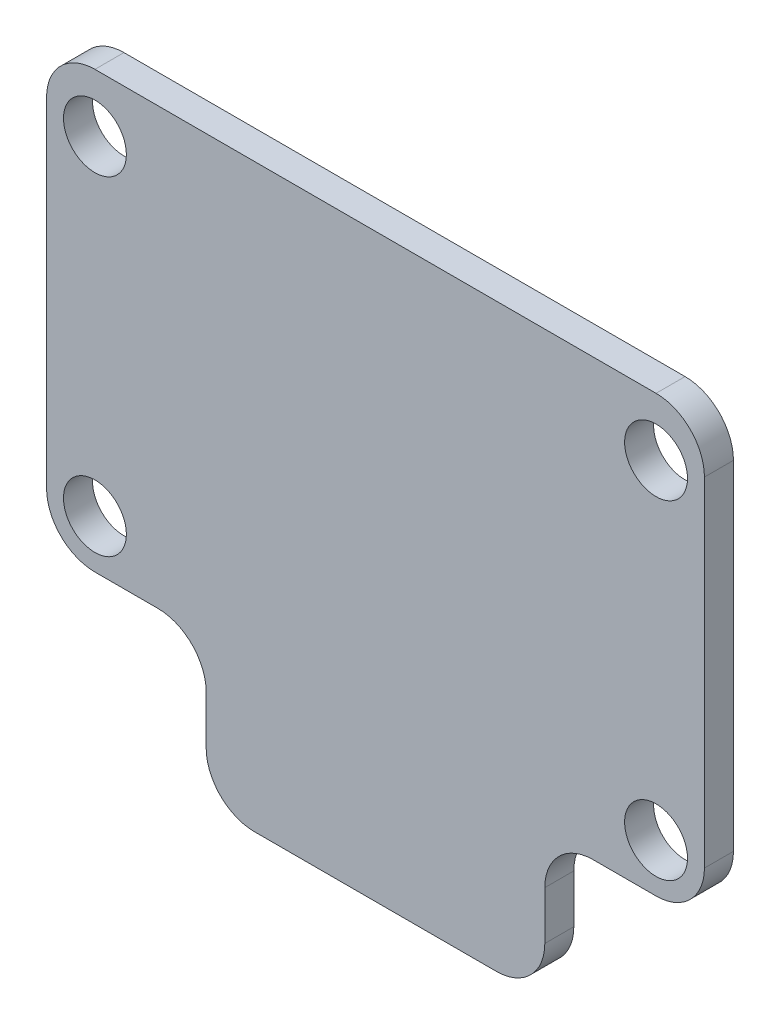
from build123d import *

# Parameters (mm, degrees)
ESQUISSE2_R        = 3.25
BOSS_EXTRU_1_DEPTH = 3
CONG_1_R           = 5


with BuildPart() as part:
    # Esquisse2 → Boss.-Extru.1 (new body)
    with BuildSketch(Plane.XY):
        Polygon((107.208492459, 1.901473412), (39.208492459, 1.901473412), (39.208492459, -43.098526588), (55.708492459, -43.098526588), (55.708492459, -58.098526588), (90.708492459, -58.098526588), (90.708492459, -43.098526588), (107.208492459, -43.098526588), align=None)
        with Locations((102.208492459, -4.098526588)):
            Circle(ESQUISSE2_R, mode=Mode.SUBTRACT)
        with Locations((102.208492459, -38.098526588)):
            Circle(ESQUISSE2_R, mode=Mode.SUBTRACT)
        with Locations((44.208492459, -38.098526588)):
            Circle(ESQUISSE2_R, mode=Mode.SUBTRACT)
        with Locations((44.208492459, -4.098526588)):
            Circle(ESQUISSE2_R, mode=Mode.SUBTRACT)
    extrude(amount=BOSS_EXTRU_1_DEPTH)

    # Congé1
    cong_1_edges = [part.edges().sort_by_distance(p)[0] for p in [
        (39.208492459, 1.901473412, 1.5),
        (39.208492459, -43.098526588, 1.5),
        (55.708492459, -58.098526588, 1.5),
        (55.708492459, -43.098526588, 1.5),
        (90.708492459, -58.098526588, 1.5),
        (90.708492459, -43.098526588, 1.5),
        (107.208492459, -43.098526588, 1.5),
        (107.208492459, 1.901473412, 1.5),
    ]]
    fillet(cong_1_edges, radius=CONG_1_R)


solid = part.part
